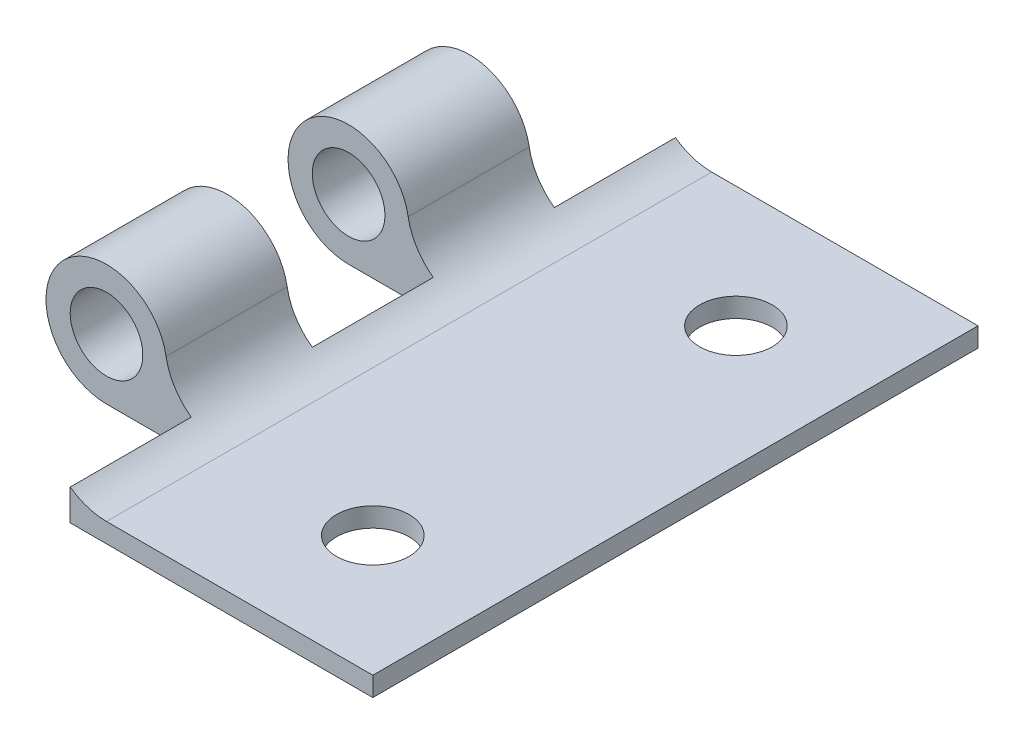
from build123d import *

# Parameters (mm, degrees)
ESBO_O1_R                = 1.5
RESSALTO_EXTRUS_O1_DEPTH = 25
ESBO_O2_R                = 1.5
ESBO_O2_W                = 6
ESBO_O2_H                = 5
CORTE_EXTRUS_O2_DEPTH    = 32.5


with BuildPart() as part:
    # Esboço1 → Ressalto-extrusão1 (new body)
    with BuildSketch(Plane.XY):
        with BuildLine():
            Line((0, 0), (-16, 0))
            ThreePointArc((-16, 0), (-18.324602514, 3.419903881), (-14.2892713, 4.32302148))
            ThreePointArc((-14.2892713, 4.32302148), (-13.800459182, 3.688284557), (-13.537523452, 2.9315197))
            ThreePointArc((-13.537523452, 2.9315197), (-12.656985327, 1.403588896), (-11, 0.8))
            Line((-11, 0.8), (0, 0.8))
            Line((0, 0.8), (0, 0))
        make_face()
        with Locations((-16, 2.5)):
            Circle(ESBO_O1_R, mode=Mode.SUBTRACT)
    extrude(amount=RESSALTO_EXTRUS_O1_DEPTH)

    # Esboço2 → Corte-extrusão2 (cut, through all)
    with BuildSketch(Plane.XZ):
        with Locations((-5, 20)):
            Circle(ESBO_O2_R)
        with Locations((-5, 5)):
            Circle(ESBO_O2_R)
        with Locations((-15.5, 2.5)):
            Rectangle(ESBO_O2_W, ESBO_O2_H)
        with Locations((-15.5, 12.5)):
            Rectangle(ESBO_O2_W, ESBO_O2_H)
        with Locations((-15.5, 22.5)):
            Rectangle(ESBO_O2_W, ESBO_O2_H)
    extrude(amount=-CORTE_EXTRUS_O2_DEPTH, mode=Mode.SUBTRACT)


solid = part.part
